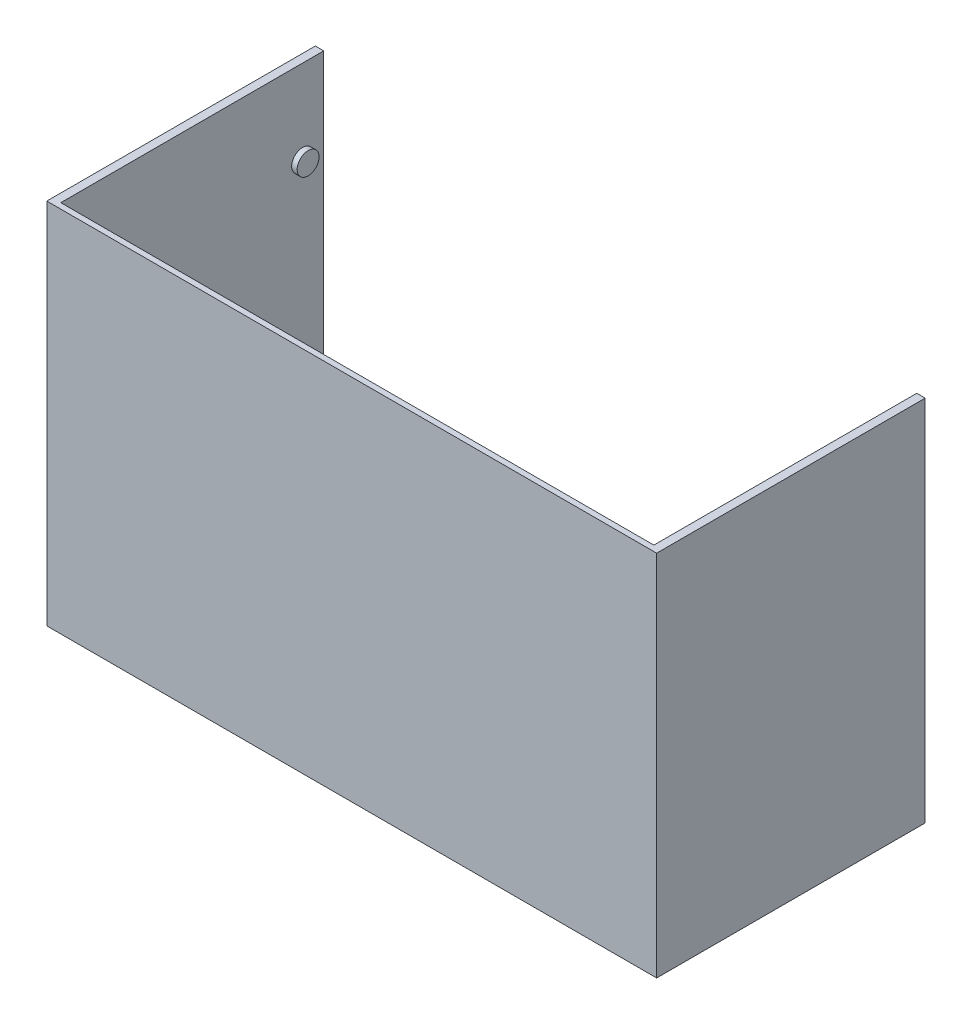
from build123d import *

# Parameters (mm, degrees)
SKETCH1_W           = 692.15
SKETCH1_H           = 417.576
BOSS_EXTRUDE1_DEPTH = 304.8
SKETCH2_W           = 673.1
SKETCH2_H           = 417.576
CUT_EXTRUDE1_DEPTH  = 298.45
SKETCH3_R           = 12.446
BOSS_EXTRUDE2_DEPTH = 15.748


with BuildPart() as part:
    # Sketch1 → Boss-Extrude1 (new body)
    with BuildSketch(Plane.XY):
        Rectangle(SKETCH1_W, SKETCH1_H)
    extrude(amount=BOSS_EXTRUDE1_DEPTH)

    # Sketch2 → Cut-Extrude1 (cut)
    with BuildSketch(Plane(origin=(0, 0, 0), x_dir=(-1, 0, 0), z_dir=(0, 0, -1))):
        Rectangle(SKETCH2_W, SKETCH2_H)
    extrude(amount=-CUT_EXTRUDE1_DEPTH, mode=Mode.SUBTRACT)

    # Sketch3 → Boss-Extrude2 (add)
    with BuildSketch(Plane.ZY.offset(346.075)):
        with Locations((23.978801103, 113.438221681)):
            Circle(SKETCH3_R)
    extrude(amount=-BOSS_EXTRUDE2_DEPTH)


solid = part.part
